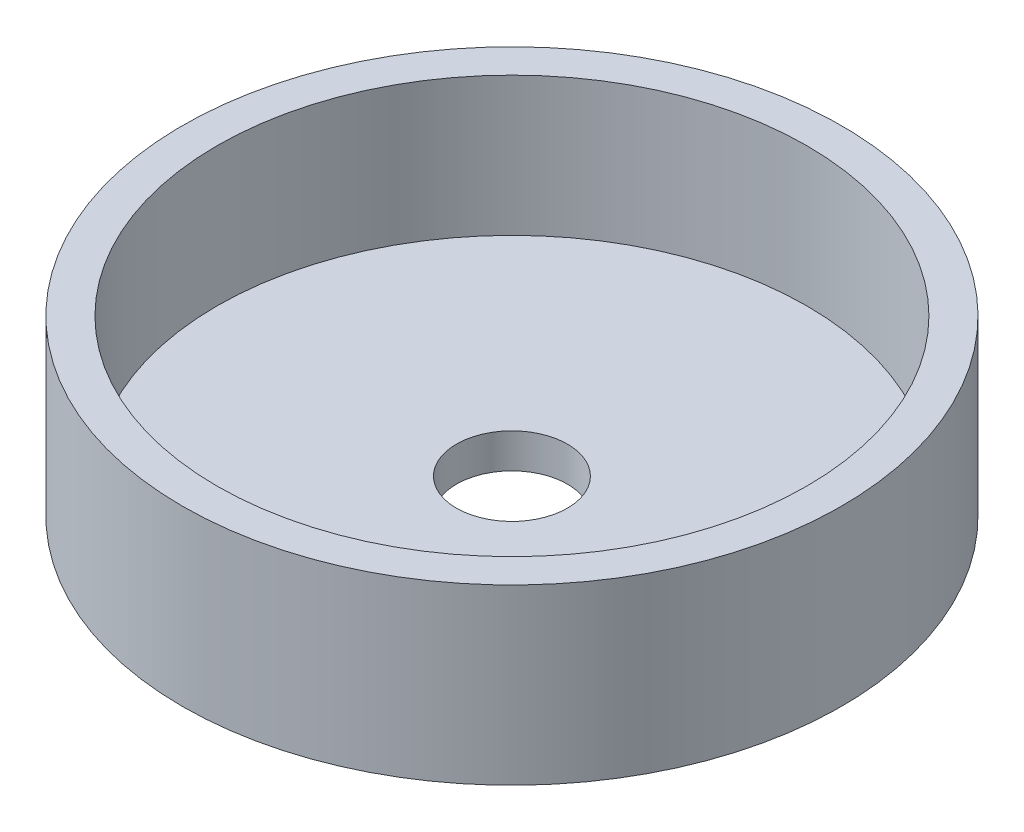
from build123d import *

# Parameters (mm, degrees)
SKETCH1_R           = 9.5
SKETCH1_R_2         = 1.6
BOSS_EXTRUDE1_DEPTH = 1
SKETCH1_3_R         = 9.5
SKETCH1_3_R_2       = 8.5
BOSS_EXTRUDE2_DEPTH = 5


with BuildPart() as part:
    # Sketch1 → Boss-Extrude1 (new body)
    with BuildSketch(Plane(origin=(0, 0, 0), x_dir=(1, 0, 0), z_dir=(0, 1, 0))):
        Circle(SKETCH1_R)
        Circle(SKETCH1_R_2, mode=Mode.SUBTRACT)
    extrude(amount=BOSS_EXTRUDE1_DEPTH)

    # Sketch1<3> → Boss-Extrude2 (add)
    with BuildSketch(Plane(origin=(0, 0, 0), x_dir=(1, 0, 0), z_dir=(0, 1, 0))):
        Circle(SKETCH1_3_R)
        Circle(SKETCH1_3_R_2, mode=Mode.SUBTRACT)
    extrude(amount=BOSS_EXTRUDE2_DEPTH)


solid = part.part
